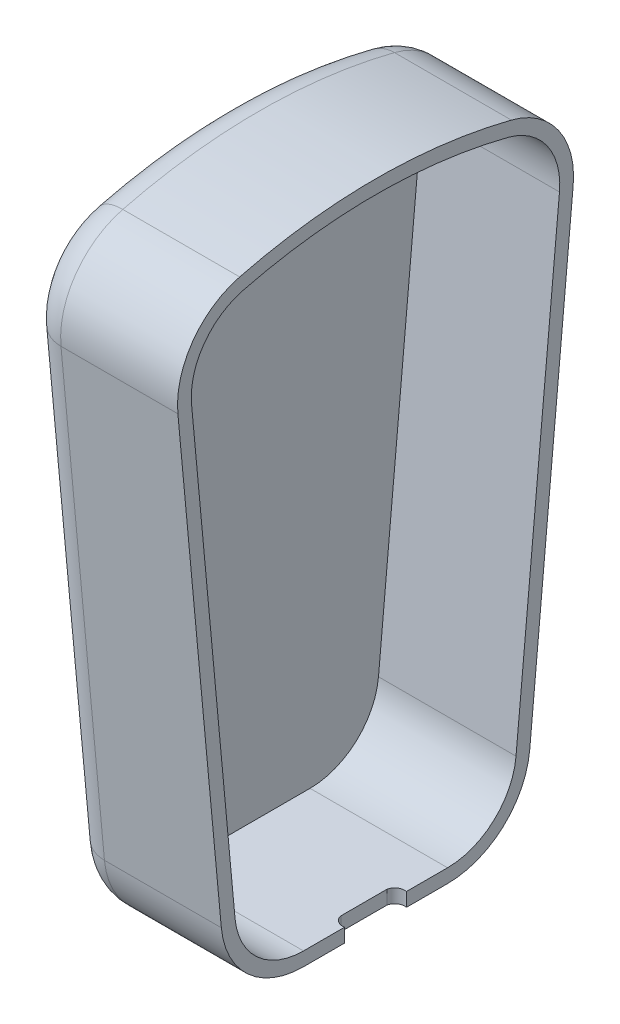
from build123d import *

# Parameters (mm, degrees)
BOSS_EXTRUDE1_DEPTH = 20
SHELL4_T            = 2
FILLET2_R           = 5
CUT_EXTRUDE1_DEPTH  = 2


with BuildPart() as part:
    # Sketch2 → Boss-Extrude1 (new body)
    with BuildSketch(Plane(origin=(0, 0, 0), x_dir=(0, 0, -1), z_dir=(1, 0, 0))):
        with BuildLine():
            Line((-26.752483981, 30.914680653), (-20.431723376, -36.982479222))
            ThreePointArc((-20.431723376, -36.982479222), (-17.210158239, -43.447078966), (-10.474775424, -46.055555556))
            Line((-10.474775424, -46.055555556), (10.474775424, -46.055555556))
            ThreePointArc((10.474775424, -46.055555556), (17.210158239, -43.447078966), (20.431723376, -36.982479222))
            Line((20.431723376, -36.982479222), (26.752483981, 30.914680653))
            ThreePointArc((26.752483981, 30.914680653), (24.966551173, 37.606542438), (19.260935813, 41.532930539))
            ThreePointArc((19.260935813, 41.532930539), (0, 43.944444444), (-19.260935813, 41.532930539))
            ThreePointArc((-19.260935813, 41.532930539), (-24.966551173, 37.606542438), (-26.752483981, 30.914680653))
        make_face()
    extrude(amount=BOSS_EXTRUDE1_DEPTH)

    # Shell4
    shell4_openings = [part.faces().sort_by_distance(p)[0] for p in [
        (20, 0.813945533, 0),
    ]]
    offset(amount=SHELL4_T, openings=shell4_openings, kind=Kind.INTERSECTION)

    # Fillet2
    # the kernel refuses this fillet: 5 mm, written as the material it takes off along each edge
    with BuildSketch(Plane(origin=(-2, -48.055555556, 10.474775424), x_dir=(1, 0, 0), z_dir=(0, 0, -1))) as fillet2_piece_1:
        with BuildLine():
            CenterArc((FILLET2_R, -FILLET2_R), FILLET2_R, 90, 90)
            Line((0, -FILLET2_R), (0, 0))
            Line((0, 0), (FILLET2_R, 0))
        make_face()
    extrude(amount=20.949550847, mode=Mode.SUBTRACT)
    with BuildSketch(Plane(origin=(-2, -36.055555556, 10.474775424), x_dir=(0, -1, 0), z_dir=(0, 0, -1))) as fillet2_piece_2:
        with BuildLine():
            CenterArc((12 - FILLET2_R, -FILLET2_R), FILLET2_R, 0, 90)
            Line((12 - FILLET2_R, 0), (12, 0))
            Line((12, 0), (12, -FILLET2_R))
        make_face()
    revolve(axis=Axis((-2, -36.055555556, 10.474775424), (-1, 0, 0)), revolution_arc=84.681483972, mode=Mode.SUBTRACT)
    with BuildSketch(Plane(origin=(-2, 30.729295919, 28.743873571), x_dir=(1, 0, 0), z_dir=(0, -0.9956947951896508, -0.09269236663414848)), Plane(origin=(-2, -37.167863955, -22.423112966), x_dir=(1, 0, 0), z_dir=(0, 0.9956947951896508, -0.09269236663414848))) as fillet2_piece_3:
        with BuildLine():
            CenterArc((FILLET2_R, -FILLET2_R), FILLET2_R, 90, 90)
            Line((0, -FILLET2_R), (0, 0))
            Line((0, 0), (FILLET2_R, 0))
        make_face()
    extrude(amount=68.190734955, mode=Mode.SUBTRACT)
    with BuildSketch(Plane(origin=(-2, 31.841604319, 16.795536029), x_dir=(0, -0.09269236663414838, 0.9956947951896509), z_dir=(0, -0.9956947951896509, -0.09269236663414838))) as fillet2_piece_4:
        with BuildLine():
            CenterArc((12 - FILLET2_R, -FILLET2_R), FILLET2_R, 0, 90)
            Line((12 - FILLET2_R, 0), (12, 0))
            Line((12, 0), (12, -FILLET2_R))
        make_face()
    revolve(axis=Axis((-2, 31.841604319, 16.795536029), (-1, 0, 0)), revolution_arc=81.045656085, mode=Mode.SUBTRACT)
    with BuildSketch(Plane(origin=(-2, -34.180555556, 0), x_dir=(0, 0.9691326220109027, 0.2465399784097355), z_dir=(0, -0.2465399784097355, 0.9691326220109027))) as fillet2_piece_5:
        with BuildLine():
            CenterArc((80.125 - FILLET2_R, -FILLET2_R), FILLET2_R, 0, 90)
            Line((80.125 - FILLET2_R, 0), (80.125, 0))
            Line((80.125, 0), (80.125, -FILLET2_R))
        make_face()
    revolve(axis=Axis((-2, -34.180555556, 0), (-1, 0, 0)), revolution_arc=28.545719886, mode=Mode.SUBTRACT)
    with BuildSketch(Plane(origin=(-2, 31.841604319, -16.795536029), x_dir=(0, 0.9691326220109029, -0.24653997840973443), z_dir=(0, 0.24653997840973443, 0.9691326220109029))) as fillet2_piece_6:
        with BuildLine():
            CenterArc((12 - FILLET2_R, -FILLET2_R), FILLET2_R, 0, 90)
            Line((12 - FILLET2_R, 0), (12, 0))
            Line((12, 0), (12, -FILLET2_R))
        make_face()
    revolve(axis=Axis((-2, 31.841604319, -16.795536029), (-1, 0, 0)), revolution_arc=81.045656085, mode=Mode.SUBTRACT)
    with BuildSketch(Plane(origin=(-2, -36.055555556, -10.474775424), x_dir=(0, -0.09269236663414783, -0.9956947951896509), z_dir=(0, 0.9956947951896509, -0.09269236663414783))) as fillet2_piece_7:
        with BuildLine():
            CenterArc((12 - FILLET2_R, -FILLET2_R), FILLET2_R, 0, 90)
            Line((12 - FILLET2_R, 0), (12, 0))
            Line((12, 0), (12, -FILLET2_R))
        make_face()
    revolve(axis=Axis((-2, -36.055555556, -10.474775424), (-1, 0, 0)), revolution_arc=84.681483972, mode=Mode.SUBTRACT)

    # Sketch3 → Cut-Extrude1 (cut)
    with BuildSketch(Plane.XZ.offset(48.055555556)):
        with BuildLine():
            Line((20, -4.5), (20, 4.5))
            ThreePointArc((20, 4.5), (18.910791668, 4.274581528), (18.3, 3.345))
            Line((18.3, 3.345), (18.3, -3.345))
            ThreePointArc((18.3, -3.345), (18.910791668, -4.274581528), (20, -4.5))
        make_face()
    extrude(amount=-CUT_EXTRUDE1_DEPTH, mode=Mode.SUBTRACT)


solid = part.part
